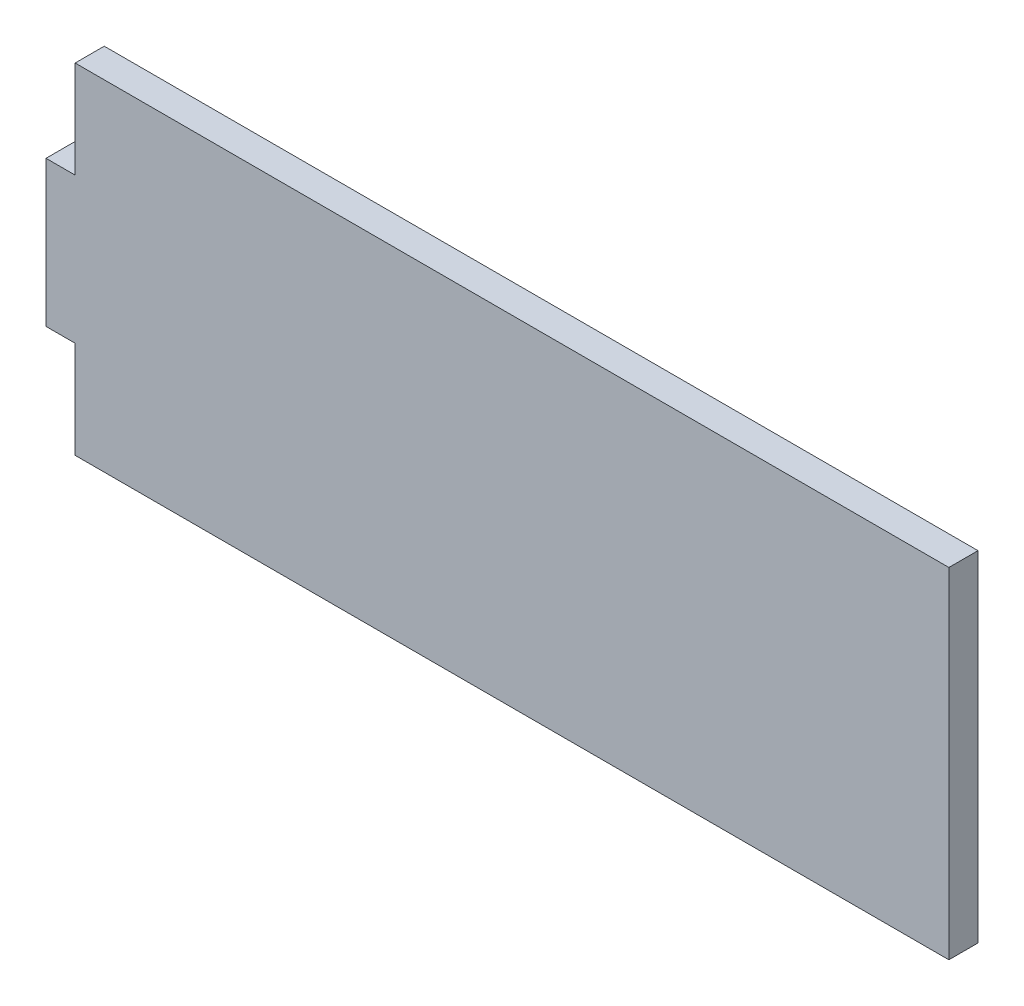
from build123d import *

# Parameters (mm, degrees)
BOSS_EXTRUDE1_DEPTH = 1.5


with BuildPart() as part:
    # Sketch1 → Boss-Extrude1 (new, symmetric)
    with BuildSketch(Plane.XY):
        Polygon((-45, -7.5), (-45, -17.5), (45, -17.5), (45, 17.5), (-45, 17.5), (-45, 7.5), (-48, 7.5), (-48, -7.5), align=None)
    extrude(amount=BOSS_EXTRUDE1_DEPTH, both=True)


solid = part.part
